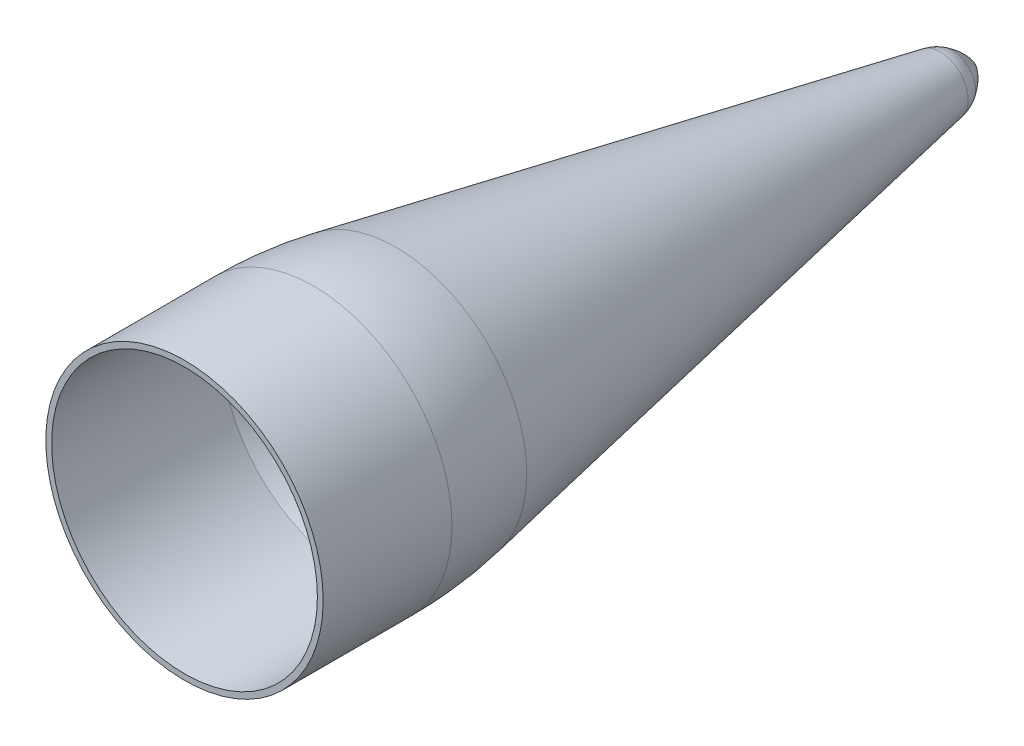
from build123d import *

# Parameters (mm, degrees)
FILLET1_R = 254
FILLET2_R = 20.32


# Read off the part's stored shape, not the designer's step: Shell1
with BuildPart() as part:
    # Sketch3 → Revolve1 (revolve)
    with BuildSketch(Plane(origin=(0, 0, 0), x_dir=(1, 0, 0), z_dir=(0, 1, 0))):
        with BuildLine():
            Line((79.375, 0), (79.375, 97.566452781))
            Line((79.375, 97.566452781), (15.414998094, 435.593871211))
            ThreePointArc((15.414998094, 435.593871211), (9.023509201, 445.178624931), (0, 452.340671834))
            Line((0, 452.340671834), (0, 431.8))
            Line((0, 431.8), (0, 0))
            Line((0, 0), (79.375, 0))
        make_face()
    revolve(axis=Axis((0, 0, -20.618215306), (0, 0, -1)))

    # Shell1 outline → Shell1 (revolve, cut)
    with BuildSketch(Plane.XZ):
        with BuildLine():
            add(Edge.make_bspline(
                [(0, -448.485192633), (8.107967388, -443.274294187), (12.248008898, -434.570694124)],
                knots=[5.283607214, 5.283607214, 5.283607214, 5.839190446, 5.839190446, 5.839190446], degree=2, weights=[1, 0.961663394, 1]))
            Line((12.248008898, -434.570694124), (76.073, -97.256805277))
            Line((76.073, -97.256805277), (76.073, 0))
            Line((76.073, 0), (0, 0))
            Line((0, 0), (0, -448.485192633))
        make_face()
    revolve(axis=Axis((0, 0, 0), (0, 0, 1)), mode=Mode.SUBTRACT)

    # Fillet1
    fillet1_edges = [part.edges().sort_by_distance(p)[0] for p in [
        (-79.375, 0, -97.566452781),
    ]]
    fillet(fillet1_edges, radius=FILLET1_R)

    # Fillet2
    fillet2_edges = [part.edges().sort_by_distance(p)[0] for p in [
        (-15.414998094, 0, -435.593871211),
    ]]
    fillet(fillet2_edges, radius=FILLET2_R)


solid = part.part
